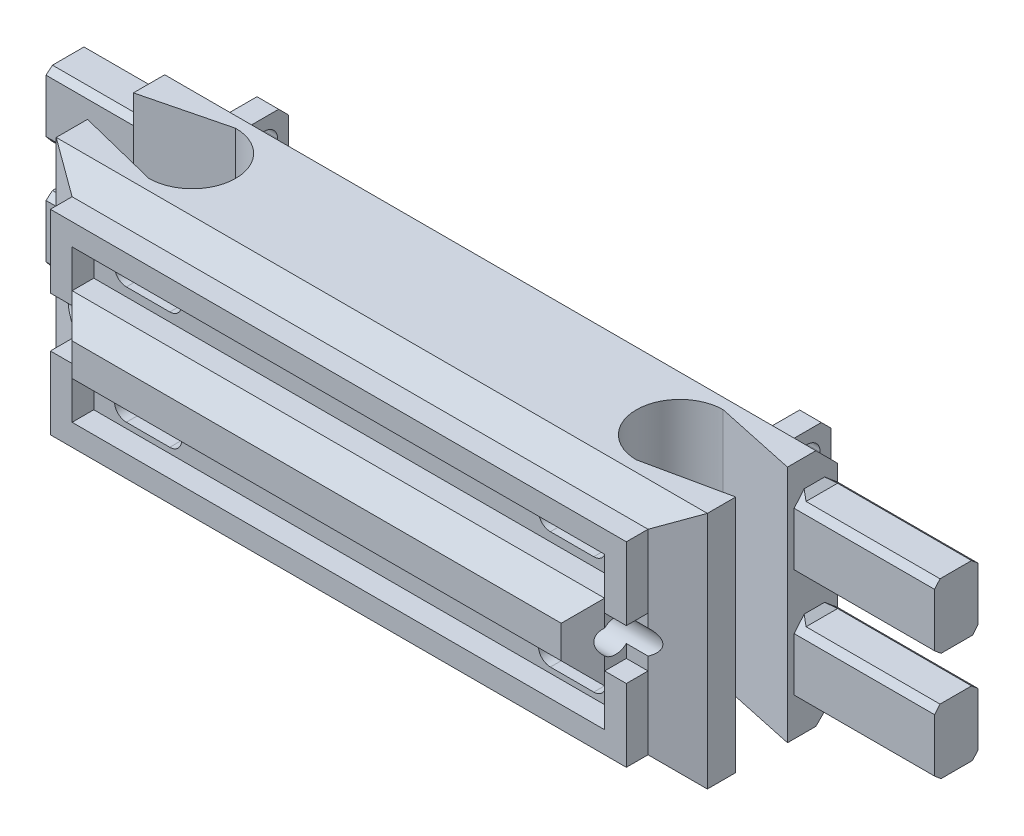
from build123d import *
from OCP.BRepFilletAPI import BRepFilletAPI_MakeChamfer

# Parameters (mm, degrees)
BASE_W                  = 30
BASE_H                  = 11
BOSS_EXTRUDE1_DEPTH     = 7
CHAMFER4_SIZE           = 1
CHAMFER5_SIZE           = 1
CHAMFER5_SIZE2          = 1.732050808
CHAMFER6_SIZE           = 1
SKETCH8_W               = 24.535898384
SKETCH8_H               = 3.5
BOSS_EXTRUDE5_DEPTH     = 2
CUT_EXTRUDE5_DEPTH      = 4.254422658
CUT_EXTRUDE5_DEPTH_BACK = 34.5
SKETCH9_R               = 0.75
CHAMFER9_SIZE           = 1
SKETCH13_W              = 9
SKETCH13_H              = 3.5
BOSS_EXTRUDE6_DEPTH     = 2
CHAMFER10_SIZE          = 1
CUT_EXTRUDE6_DEPTH      = 3
CUT_EXTRUDE6_DEPTH_BACK = 30
SKETCH14_R              = 0.75
SKETCH15_W              = 1
SKETCH15_H              = 3.75
BOSS_EXTRUDE7_DEPTH     = 2
CUT_EXTRUDE7_DEPTH      = 26
CHAMFER11_SIZE          = 0.3
CHAMFER12_SIZE          = 0.75
CUT_EXTRUDE8_DEPTH      = 11
SKETCH18_W              = 2
SKETCH18_H              = 3
BOSS_EXTRUDE8_DEPTH     = 6.47
CHAMFER13_SIZE          = 0.25
CHAMFER13_SIZE2         = 0.297938398
CHAMFER14_SIZE          = 0.25
CHAMFER14_SIZE2         = 0.297938398
SKETCH19_W              = 2
SKETCH19_H              = 3
BOSS_EXTRUDE9_DEPTH     = 4.47
CHAMFER15_SIZE          = 0.25
CHAMFER15_SIZE2         = 0.297938398
CHAMFER16_SIZE          = 0.25
CHAMFER16_SIZE2         = 0.297938398
SKETCH20_W              = 1
SKETCH20_H              = 2.345491503
SKETCH20_W_2            = 26.535898384
SKETCH20_H_2            = 1
BOSS_EXTRUDE10_DEPTH    = 1
CUT_EXTRUDE9_DEPTH      = 1


with BuildPart() as part:
    # Base → Boss-Extrude1 (new body)
    with BuildSketch(Plane.XY):
        with Locations((15, 5.5)):
            Rectangle(BASE_W, BASE_H)
    extrude(amount=BOSS_EXTRUDE1_DEPTH)

    # Chamfer4
    chamfer4_edges = [part.edges().sort_by_distance(p)[0] for p in [
        (15, 11, 7),
        (15, 0, 7),
    ]]
    chamfer(chamfer4_edges, length=CHAMFER4_SIZE)

    # Chamfer5: one chamfer whose edges measure the first distance from different faces: ONE call of the kernel's chamfer builder (chamfer() names one face for all edges)
    chamfer5_edges_1 = [part.edges().sort_by_distance(p)[0] for p in [
        (0, 5.5, 7),
    ]]
    chamfer5_side_1 = [part.faces().sort_by_distance(p)[0] for p in [
        (0, 5.5, 3.458333333),
    ]]
    chamfer5_edges_2 = [part.edges().sort_by_distance(p)[0] for p in [
        (30, 5.5, 7),
    ]]
    chamfer5_side_2 = [part.faces().sort_by_distance(p)[0] for p in [
        (30, 5.5, 3.458333333),
    ]]
    chamfer5 = BRepFilletAPI_MakeChamfer(part.part.solid().wrapped)
    for e in chamfer5_edges_1:
        chamfer5.Add(CHAMFER5_SIZE, CHAMFER5_SIZE2, e.wrapped, chamfer5_side_1[0].wrapped)  # the first distance lies on this face
    for e in chamfer5_edges_2:
        chamfer5.Add(CHAMFER5_SIZE, CHAMFER5_SIZE2, e.wrapped, chamfer5_side_2[0].wrapped)  # the first distance lies on this face
    add(Compound.cast(chamfer5.Shape()), mode=Mode.REPLACE)

    # Chamfer6
    chamfer6_edges = [part.edges().sort_by_distance(p)[0] for p in [
        (15, 11, 0),
        (15, 0, 0),
    ]]
    chamfer(chamfer6_edges, length=CHAMFER6_SIZE)

    # Sketch8 → Boss-Extrude5 (add)
    with BuildSketch(Plane.XY.offset(7)):
        with Locations((15, 5.5)):
            Rectangle(SKETCH8_W, SKETCH8_H)
    extrude(amount=BOSS_EXTRUDE5_DEPTH)

    # Sketch9 → Cut-Extrude5 (cut, two sides: drawn at the far end of the back side and taken through both)
    with BuildSketch(Plane(origin=(27.267949192, 0, 0), x_dir=(0, 0, -1), z_dir=(1, 0, 0)).offset(-CUT_EXTRUDE5_DEPTH_BACK)):
        with Locations(Location((-7.5, 5.5, 0), (0, 0, 311.810314896))):
            Circle(SKETCH9_R)
    extrude(amount=CUT_EXTRUDE5_DEPTH + CUT_EXTRUDE5_DEPTH_BACK, mode=Mode.SUBTRACT)

    # Chamfer9
    # the kernel refuses this chamfer: 1 mm, written as the material it takes off along each edge
    with BuildSketch(Plane(origin=(29.83963218, 3.75, 9), x_dir=(0, -0.027495876610586487, -0.9996219169112968), z_dir=(-1, 0, 0)), Plane(origin=(0.16036782, 7.25, 9), x_dir=(0, 0.027495876610586487, -0.9996219169112968), z_dir=(1, 0, 0))) as chamfer9_piece_1:
        Polygon((CHAMFER9_SIZE * 0.999621916911, -CHAMFER9_SIZE * 0.0274958766106), (-CHAMFER9_SIZE * 0.0274958766106, -CHAMFER9_SIZE * 0.999621916911), (0, 0), align=None)
    extrude(amount=29.679264361, mode=Mode.SUBTRACT)
    with BuildSketch(Plane(origin=(27.267949192, 9.821682988, 9), x_dir=(0.027495876610585623, 0, -0.9996219169112968), z_dir=(0, -1, 0)), Plane(origin=(2.732050808, 1.178317012, 9), x_dir=(-0.027495876610586487, 0, -0.9996219169112968), z_dir=(0, 1, 0))) as chamfer9_piece_2:
        Polygon((CHAMFER9_SIZE * 0.999621916911, -CHAMFER9_SIZE * 0.0274958766106), (-CHAMFER9_SIZE * 0.0274958766106, -CHAMFER9_SIZE * 0.999621916911), (0, 0), align=None)
    extrude(amount=8.643365976, mode=Mode.SUBTRACT)

    # Sketch13 → Boss-Extrude6 (add)
    with BuildSketch(Plane(origin=(0, 0, 0), x_dir=(-1, 0, 0), z_dir=(0, 0, -1))):
        with Locations((-5.5, 5.5)):
            Rectangle(SKETCH13_W, SKETCH13_H)
        with Locations((-24.5, 5.5)):
            Rectangle(SKETCH13_W, SKETCH13_H)
    extrude(amount=BOSS_EXTRUDE6_DEPTH)

    # Chamfer10
    chamfer10_edges = [part.edges().sort_by_distance(p)[0] for p in [
        (24.5, 7.25, -2),
        (29, 5.5, -2),
        (24.5, 3.75, -2),
        (20, 5.5, -2),
        (10, 5.5, -2),
        (5.5, 3.75, -2),
        (1, 5.5, -2),
        (5.5, 7.25, -2),
    ]]
    chamfer(chamfer10_edges, length=CHAMFER10_SIZE)

    # Sketch14 → Cut-Extrude6 (cut, two sides: drawn at the far end of the back side and taken through both)
    with BuildSketch(Plane.ZY.offset(-1).offset(-CUT_EXTRUDE6_DEPTH_BACK)):
        with Locations(Location((-0.5, 5.5, 0), (0, 0, 48.189685104))):
            Circle(SKETCH14_R)
    extrude(amount=CUT_EXTRUDE6_DEPTH + CUT_EXTRUDE6_DEPTH_BACK, mode=Mode.SUBTRACT)

    # Sketch15 → Boss-Extrude7 (add)
    with BuildSketch(Plane(origin=(0, 0, 0), x_dir=(-1, 0, 0), z_dir=(0, 0, -1))):
        with Locations((-27.5, 2.875)):
            Rectangle(SKETCH15_W, SKETCH15_H)
        with Locations((-27.5, 8.125)):
            Rectangle(SKETCH15_W, SKETCH15_H)
        with Locations((-2.5, 2.875)):
            Rectangle(SKETCH15_W, SKETCH15_H)
        with Locations((-2.5, 8.125)):
            Rectangle(SKETCH15_W, SKETCH15_H)
    extrude(amount=BOSS_EXTRUDE7_DEPTH)

    # Sketch16 → Cut-Extrude7 (cut)
    with BuildSketch(Plane(origin=(28, 0, 0), x_dir=(0, 0, -1), z_dir=(1, 0, 0))):
        with BuildLine():
            Line((1.2, 3.15), (1.2, 2.15))
            ThreePointArc((1.2, 2.15), (0.6, 1.55), (0, 2.15))
            Line((0, 2.15), (0, 3.15))
            ThreePointArc((0, 3.15), (0.6, 3.75), (1.2, 3.15))
        make_face()
        with BuildLine():
            Line((0, 7.85), (0, 8.85))
            ThreePointArc((0, 8.85), (0.6, 9.45), (1.2, 8.85))
            Line((1.2, 8.85), (1.2, 7.85))
            ThreePointArc((1.2, 7.85), (0.6, 7.25), (0, 7.85))
        make_face()
    extrude(amount=-CUT_EXTRUDE7_DEPTH, mode=Mode.SUBTRACT)

    # Chamfer11
    chamfer11_edges = [part.edges().sort_by_distance(p)[0] for p in [
        (28, 2.875, -2),
        (27, 2.875, -2),
        (2, 2.875, -2),
        (3, 2.875, -2),
        (28, 8.125, -2),
        (27, 8.125, -2),
        (2, 8.125, -2),
        (3, 8.125, -2),
    ]]
    chamfer(chamfer11_edges, length=CHAMFER11_SIZE)

    # Chamfer12
    chamfer12_edges = [part.edges().sort_by_distance(p)[0] for p in [
        (27.5, 1, -2),
        (27.5, 10, -2),
        (2.5, 10, -2),
        (2.5, 1, -2),
    ]]
    chamfer(chamfer12_edges, length=CHAMFER12_SIZE)

    # Tendon extrude → Cut-Extrude8 (cut)
    with BuildSketch(Plane.XZ):
        with BuildLine():
            Line((0, 4.5575), (0, 2.4425))
            Line((0, 2.4425), (3.77, 1.5))
            ThreePointArc((3.77, 1.5), (5.77, 3.5), (3.77, 5.5))
            Line((3.77, 5.5), (0, 4.5575))
        make_face()
        with BuildLine():
            Line((30, 2.307857143), (30, 4.692142857))
            Line((30, 4.692142857), (26.23, 5.5))
            ThreePointArc((26.23, 5.5), (24.23, 3.5), (26.23, 1.5))
            Line((26.23, 1.5), (30, 2.307857143))
        make_face()
    extrude(amount=-CUT_EXTRUDE8_DEPTH, mode=Mode.SUBTRACT)

    # Sketch18 → Boss-Extrude8 (add)
    with BuildSketch(Plane(origin=(30, 0, 0), x_dir=(0, 0, -1), z_dir=(1, 0, 0))):
        with Locations((-1, 8)):
            Rectangle(SKETCH18_W, SKETCH18_H)
        with Locations((-1, 3)):
            Rectangle(SKETCH18_W, SKETCH18_H)
    extrude(amount=BOSS_EXTRUDE8_DEPTH)

    # Chamfer13: one chamfer whose edges measure the first distance from different faces: ONE call of the kernel's chamfer builder (chamfer() names one face for all edges)
    chamfer13_edges_1 = [part.edges().sort_by_distance(p)[0] for p in [
        (33.235, 9.5, 2),
    ]]
    chamfer13_side_1 = [part.faces().sort_by_distance(p)[0] for p in [
        (33.235, 9.5, 1),
    ]]
    chamfer13_edges_2 = [part.edges().sort_by_distance(p)[0] for p in [
        (33.235, 6.5, 2),
    ]]
    chamfer13_side_2 = [part.faces().sort_by_distance(p)[0] for p in [
        (33.235, 8, 2),
    ]]
    chamfer13_edges_3 = [part.edges().sort_by_distance(p)[0] for p in [
        (33.235, 6.5, 0),
    ]]
    chamfer13_side_3 = [part.faces().sort_by_distance(p)[0] for p in [
        (33.235, 6.5, 1),
    ]]
    chamfer13_edges_4 = [part.edges().sort_by_distance(p)[0] for p in [
        (33.235, 9.5, 0),
    ]]
    chamfer13_side_4 = [part.faces().sort_by_distance(p)[0] for p in [
        (18.140512062, 8.262600161, 0),
    ]]
    chamfer13_edges_5 = [part.edges().sort_by_distance(p)[0] for p in [
        (33.235, 4.5, 2),
    ]]
    chamfer13_side_5 = [part.faces().sort_by_distance(p)[0] for p in [
        (33.235, 4.5, 1),
    ]]
    chamfer13_edges_6 = [part.edges().sort_by_distance(p)[0] for p in [
        (33.235, 1.5, 2),
    ]]
    chamfer13_side_6 = [part.faces().sort_by_distance(p)[0] for p in [
        (33.235, 3, 2),
    ]]
    chamfer13_edges_7 = [part.edges().sort_by_distance(p)[0] for p in [
        (33.235, 1.5, 0),
    ]]
    chamfer13_side_7 = [part.faces().sort_by_distance(p)[0] for p in [
        (33.235, 1.5, 1),
    ]]
    chamfer13_edges_8 = [part.edges().sort_by_distance(p)[0] for p in [
        (33.235, 4.5, 0),
    ]]
    chamfer13_side_8 = [part.faces().sort_by_distance(p)[0] for p in [
        (18.140512062, 2.737399839, 0),
    ]]
    chamfer13 = BRepFilletAPI_MakeChamfer(part.part.solid().wrapped)
    for e in chamfer13_edges_1:
        chamfer13.Add(CHAMFER13_SIZE, CHAMFER13_SIZE2, e.wrapped, chamfer13_side_1[0].wrapped)  # the first distance lies on this face
    for e in chamfer13_edges_2:
        chamfer13.Add(CHAMFER13_SIZE, CHAMFER13_SIZE2, e.wrapped, chamfer13_side_2[0].wrapped)  # the first distance lies on this face
    for e in chamfer13_edges_3:
        chamfer13.Add(CHAMFER13_SIZE, CHAMFER13_SIZE2, e.wrapped, chamfer13_side_3[0].wrapped)  # the first distance lies on this face
    for e in chamfer13_edges_4:
        chamfer13.Add(CHAMFER13_SIZE, CHAMFER13_SIZE2, e.wrapped, chamfer13_side_4[0].wrapped)  # the first distance lies on this face
    for e in chamfer13_edges_5:
        chamfer13.Add(CHAMFER13_SIZE, CHAMFER13_SIZE2, e.wrapped, chamfer13_side_5[0].wrapped)  # the first distance lies on this face
    for e in chamfer13_edges_6:
        chamfer13.Add(CHAMFER13_SIZE, CHAMFER13_SIZE2, e.wrapped, chamfer13_side_6[0].wrapped)  # the first distance lies on this face
    for e in chamfer13_edges_7:
        chamfer13.Add(CHAMFER13_SIZE, CHAMFER13_SIZE2, e.wrapped, chamfer13_side_7[0].wrapped)  # the first distance lies on this face
    for e in chamfer13_edges_8:
        chamfer13.Add(CHAMFER13_SIZE, CHAMFER13_SIZE2, e.wrapped, chamfer13_side_8[0].wrapped)  # the first distance lies on this face
    add(Compound.cast(chamfer13.Shape()), mode=Mode.REPLACE)

    # Chamfer14
    chamfer14_edges = [part.edges().sort_by_distance(p)[0] for p in [
        (30, 1.5, 0.976030801),
        (30, 4.5, 1.023969199),
        (30, 6.5, 0.976030801),
        (30, 9.5, 1.023969199),
    ]]
    chamfer14_side = [part.faces().sort_by_distance(p)[0] for p in [
        (30, 5.5, 1.3801438),
    ]]
    chamfer(chamfer14_edges, length=CHAMFER14_SIZE, length2=CHAMFER14_SIZE2, reference=chamfer14_side[0])

    # Sketch19 → Boss-Extrude9 (add)
    with BuildSketch(Plane.ZY):
        with Locations((1, 3)):
            Rectangle(SKETCH19_W, SKETCH19_H)
        with Locations((1, 8)):
            Rectangle(SKETCH19_W, SKETCH19_H)
    extrude(amount=BOSS_EXTRUDE9_DEPTH)

    # Chamfer15: one chamfer whose edges measure the first distance from different faces: ONE call of the kernel's chamfer builder (chamfer() names one face for all edges)
    chamfer15_edges_1 = [part.edges().sort_by_distance(p)[0] for p in [
        (-2.235, 4.5, 0),
    ]]
    chamfer15_side_1 = [part.faces().sort_by_distance(p)[0] for p in [
        (-2.235, 4.5, 1),
    ]]
    chamfer15_edges_2 = [part.edges().sort_by_distance(p)[0] for p in [
        (-2.235, 1.5, 0),
    ]]
    chamfer15_side_2 = [part.faces().sort_by_distance(p)[0] for p in [
        (15.474631464, 2.761637884, 0),
    ]]
    chamfer15_edges_3 = [part.edges().sort_by_distance(p)[0] for p in [
        (-2.235, 1.5, 2),
    ]]
    chamfer15_side_3 = [part.faces().sort_by_distance(p)[0] for p in [
        (-2.235, 1.5, 1),
    ]]
    chamfer15_edges_4 = [part.edges().sort_by_distance(p)[0] for p in [
        (-2.235, 4.5, 2),
    ]]
    chamfer15_side_4 = [part.faces().sort_by_distance(p)[0] for p in [
        (-2.235, 3, 2),
    ]]
    chamfer15_edges_5 = [part.edges().sort_by_distance(p)[0] for p in [
        (-2.235, 6.5, 0),
    ]]
    chamfer15_side_5 = [part.faces().sort_by_distance(p)[0] for p in [
        (15.474631464, 8.244567189, 0),
    ]]
    chamfer15_edges_6 = [part.edges().sort_by_distance(p)[0] for p in [
        (-2.235, 6.5, 2),
    ]]
    chamfer15_side_6 = [part.faces().sort_by_distance(p)[0] for p in [
        (-2.235, 6.5, 1),
    ]]
    chamfer15_edges_7 = [part.edges().sort_by_distance(p)[0] for p in [
        (-2.235, 9.5, 2),
    ]]
    chamfer15_side_7 = [part.faces().sort_by_distance(p)[0] for p in [
        (-2.235, 8, 2),
    ]]
    chamfer15_edges_8 = [part.edges().sort_by_distance(p)[0] for p in [
        (-2.235, 9.5, 0),
    ]]
    chamfer15_side_8 = [part.faces().sort_by_distance(p)[0] for p in [
        (-2.235, 9.5, 1),
    ]]
    chamfer15 = BRepFilletAPI_MakeChamfer(part.part.solid().wrapped)
    for e in chamfer15_edges_1:
        chamfer15.Add(CHAMFER15_SIZE, CHAMFER15_SIZE2, e.wrapped, chamfer15_side_1[0].wrapped)  # the first distance lies on this face
    for e in chamfer15_edges_2:
        chamfer15.Add(CHAMFER15_SIZE, CHAMFER15_SIZE2, e.wrapped, chamfer15_side_2[0].wrapped)  # the first distance lies on this face
    for e in chamfer15_edges_3:
        chamfer15.Add(CHAMFER15_SIZE, CHAMFER15_SIZE2, e.wrapped, chamfer15_side_3[0].wrapped)  # the first distance lies on this face
    for e in chamfer15_edges_4:
        chamfer15.Add(CHAMFER15_SIZE, CHAMFER15_SIZE2, e.wrapped, chamfer15_side_4[0].wrapped)  # the first distance lies on this face
    for e in chamfer15_edges_5:
        chamfer15.Add(CHAMFER15_SIZE, CHAMFER15_SIZE2, e.wrapped, chamfer15_side_5[0].wrapped)  # the first distance lies on this face
    for e in chamfer15_edges_6:
        chamfer15.Add(CHAMFER15_SIZE, CHAMFER15_SIZE2, e.wrapped, chamfer15_side_6[0].wrapped)  # the first distance lies on this face
    for e in chamfer15_edges_7:
        chamfer15.Add(CHAMFER15_SIZE, CHAMFER15_SIZE2, e.wrapped, chamfer15_side_7[0].wrapped)  # the first distance lies on this face
    for e in chamfer15_edges_8:
        chamfer15.Add(CHAMFER15_SIZE, CHAMFER15_SIZE2, e.wrapped, chamfer15_side_8[0].wrapped)  # the first distance lies on this face
    add(Compound.cast(chamfer15.Shape()), mode=Mode.REPLACE)

    # Chamfer16
    chamfer16_edges = [part.edges().sort_by_distance(p)[0] for p in [
        (0, 1.5, 1.023969199),
        (0, 4.5, 0.976030801),
        (0, 9.5, 0.976030801),
        (0, 6.5, 1.023969199),
    ]]
    chamfer16_side = [part.faces().sort_by_distance(p)[0] for p in [
        (0, 5.5, 1.485621458),
    ]]
    chamfer(chamfer16_edges, length=CHAMFER16_SIZE, length2=CHAMFER16_SIZE2, reference=chamfer16_side[0])

    # Sketch20 → Boss-Extrude10 (add)
    with BuildSketch(Plane.XY.offset(7)):
        Polygon((2.732050808, 9), (1.732050808, 9), (1.732050808, 6.654508497), (2.732050808, 6.654508497), (2.732050808, 7.25), align=None)
        Polygon((28.267949192, 10), (1.732050808, 10), (1.732050808, 9), (2.732050808, 9), (27.267949192, 9), (28.267949192, 9), align=None)
        Polygon((28.267949192, 6.654508497), (28.267949192, 9), (27.267949192, 9), (27.267949192, 7.25), (27.267949192, 6.654508497), align=None)
        with Locations((27.767949192, 3.172745751)):
            Rectangle(SKETCH20_W, SKETCH20_H)
        with Locations((15, 1.5)):
            Rectangle(SKETCH20_W_2, SKETCH20_H_2)
        with Locations((2.232050808, 3.172745751)):
            Rectangle(SKETCH20_W, SKETCH20_H)
    extrude(amount=BOSS_EXTRUDE10_DEPTH)

    # Sketch21 → Cut-Extrude9 (cut)
    with BuildSketch(Plane.XY.offset(7)):
        with BuildLine():
            Line((4.232050808, 8.746865984), (6.232050808, 8.746865984))
            ThreePointArc((6.232050808, 8.746865984), (6.778916791, 8.2), (6.232050808, 7.653134016))
            Line((6.232050808, 7.653134016), (4.232050808, 7.653134016))
            ThreePointArc((4.232050808, 7.653134016), (3.685184824, 8.2), (4.232050808, 8.746865984))
        make_face()
        with BuildLine():
            Line((23.767949192, 8.746865984), (25.767949192, 8.746865984))
            ThreePointArc((25.767949192, 8.746865984), (26.314815176, 8.2), (25.767949192, 7.653134016))
            Line((25.767949192, 7.653134016), (23.767949192, 7.653134016))
            ThreePointArc((23.767949192, 7.653134016), (23.221083209, 8.2), (23.767949192, 8.746865984))
        make_face()
        with BuildLine():
            Line((23.767949192, 3.346865984), (25.767949192, 3.346865984))
            ThreePointArc((25.767949192, 3.346865984), (26.314815176, 2.8), (25.767949192, 2.253134016))
            Line((25.767949192, 2.253134016), (23.767949192, 2.253134016))
            ThreePointArc((23.767949192, 2.253134016), (23.221083209, 2.8), (23.767949192, 3.346865984))
        make_face()
        with BuildLine():
            Line((6.232050808, 2.253134016), (4.232050808, 2.253134016))
            ThreePointArc((4.232050808, 2.253134016), (3.685184824, 2.8), (4.232050808, 3.346865984))
            Line((4.232050808, 3.346865984), (6.232050808, 3.346865984))
            ThreePointArc((6.232050808, 3.346865984), (6.778916791, 2.8), (6.232050808, 2.253134016))
        make_face()
    extrude(amount=-CUT_EXTRUDE9_DEPTH, mode=Mode.SUBTRACT)


solid = part.part
